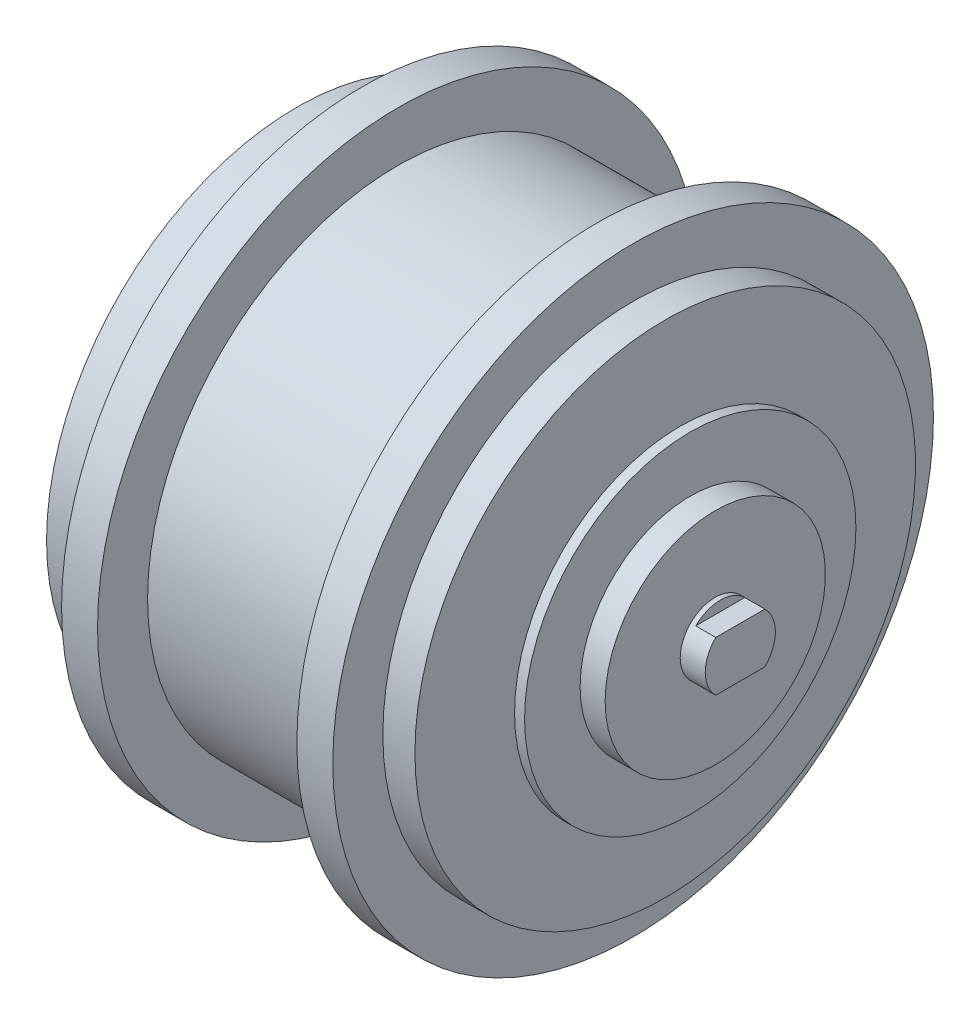
from build123d import *

# Parameters (mm, degrees)
CUT_EXTRUDE1_DEPTH      = 4
CUT_EXTRUDE2_DEPTH      = 139.260282077
CUT_EXTRUDE2_DEPTH_BACK = 3
SKETCH3_R               = 8.5


with BuildPart() as part:
    # Sketch1 → Revolve1 (revolve)
    with BuildSketch(Plane.XY):
        Polygon((0, 0), (0, 6), (33, 6), (33, 8.5), (43.5, 8.5), (43.5, 17), (46.5, 17), (46.5, 36.31855833), (53.568965517, 50), (66.568965517, 50), (66.568965517, 60), (73.751034483, 60), (73.751034483, 50), (113.568965517, 50), (113.568965517, 60), (120.751034483, 60), (120.751034483, 50), (127.16, 50), (127.16, 22), (130.16, 22), (130.16, 33.1), (132.16, 33.1), (132.16, 22), (137.16, 22), (137.16, 7), (142.16, 7), (142.16, 0), align=None)
    revolve(axis=Axis((0, 0, 0), (1, 0, 0)))

    # Sketch2 → Cut-Extrude1 (cut)
    with BuildSketch(Plane(origin=(142.16, 0, 0), x_dir=(0, 0, -1), z_dir=(1, 0, 0))):
        with BuildLine():
            Line((-4.898979486, 5), (4.898979486, 5))
            ThreePointArc((4.898979486, 5), (0, 7), (-4.898979486, 5))
        make_face()
        with BuildLine():
            Line((-4.898979486, -5), (4.898979486, -5))
            ThreePointArc((4.898979486, -5), (0, -7), (-4.898979486, -5))
        make_face()
    extrude(amount=-CUT_EXTRUDE1_DEPTH, mode=Mode.SUBTRACT)

    # Sketch3 → Cut-Extrude2 (cut, two sides: drawn at the far end of the back side and taken through both)
    with BuildSketch(Plane.ZY.offset(-33).offset(-CUT_EXTRUDE2_DEPTH_BACK)):
        Circle(SKETCH3_R)
    extrude(amount=CUT_EXTRUDE2_DEPTH + CUT_EXTRUDE2_DEPTH_BACK, mode=Mode.SUBTRACT)


solid = part.part
